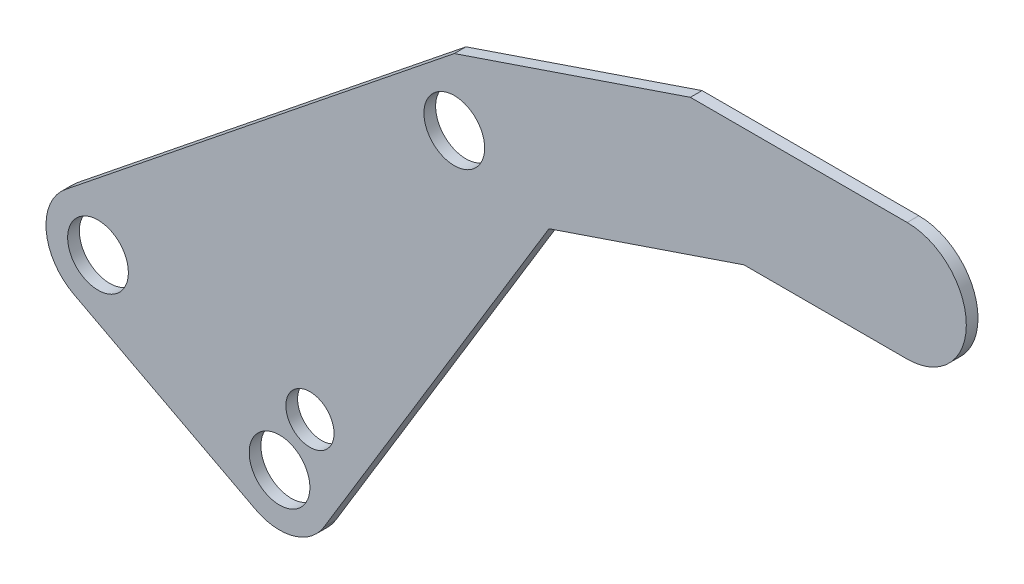
from build123d import *

# Parameters (mm, degrees)
BOSS_EXTRUDE1_START = 350
SKETCH2_R           = 14.005
SKETCH2_R_2         = 11.115
BOSS_EXTRUDE1_DEPTH = 2.695


with BuildPart() as part:
    # Sketch2 → Boss-Extrude1 (new, symmetric)
    with BuildSketch(Plane.XY.offset(BOSS_EXTRUDE1_START)):
        with BuildLine():
            Line((214.227349762, 189.072586466), (289.227349762, 189.072586466))
            ThreePointArc((289.227349762, 189.072586466), (316.789067179, 216.224496297), (289.49987329, 243.65029385))
            Line((289.49987329, 243.65029385), (189.49987329, 243.65029385))
            Line((189.49987329, 243.65029385), (80.603602302, 206.682711227))
            Line((80.603602302, 206.682711227), (-98.76712644, 62.716945608))
            ThreePointArc((-98.76712644, 62.716945608), (-107.633450499, 41.692754011), (-94.907402465, 22.7540097))
            Line((-94.907402465, 22.7540097), (-11.162790698, -21.2459903))
            ThreePointArc((-11.162790698, -21.2459903), (6.420447051, -23.125264532), (20.518118604, -12.45017305))
            Line((20.518118604, -12.45017305), (124.269560685, 158.534148647))
            Line((124.269560685, 158.534148647), (214.227349762, 189.072586466))
        make_face()
        with Locations((-83.744611767, 44)):
            Circle(SKETCH2_R, mode=Mode.SUBTRACT)
        Circle(SKETCH2_R, mode=Mode.SUBTRACT)
        with Locations((80.603602302, 175.90845927)):
            Circle(SKETCH2_R, mode=Mode.SUBTRACT)
        with Locations((14.026949941, 27.195673835)):
            Circle(SKETCH2_R_2, mode=Mode.SUBTRACT)
    extrude(amount=BOSS_EXTRUDE1_DEPTH, both=True)


solid = part.part
